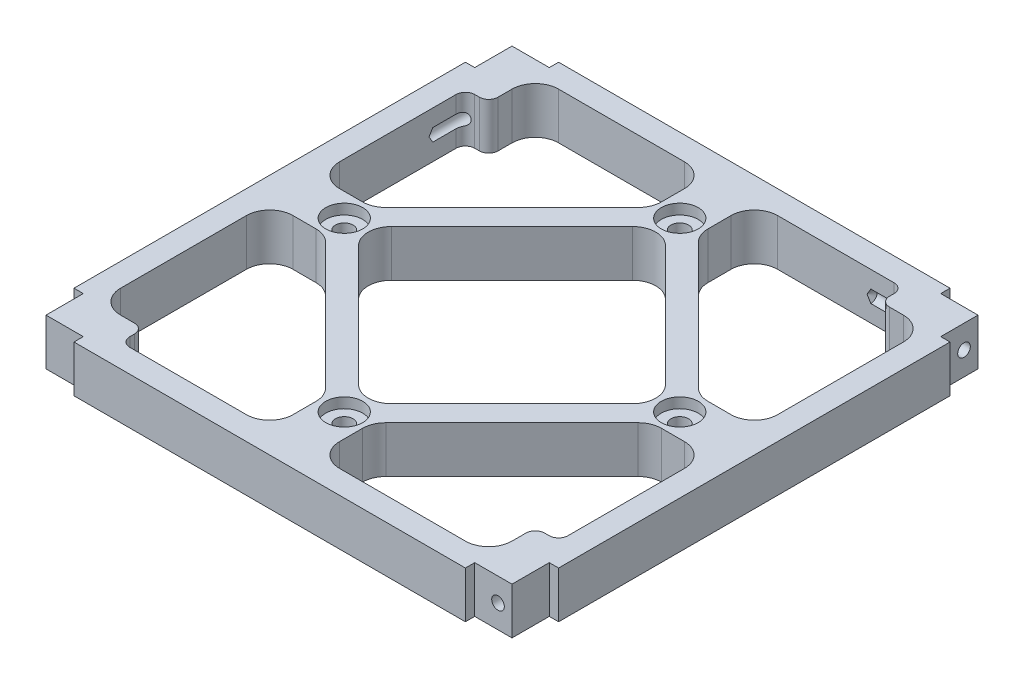
from build123d import *

# Parameters (mm, degrees)
SKETCH1_W                                           = 104
SKETCH1_H                                           = 104
BOSS_EXTRUDE1_DEPTH                                 = 10
FILLET1_R                                           = 5
CUT_EXTRUDE1_DEPTH                                  = 75.215901261
CIRPATTERN1_COUNT                                   = 4
CBORE_FOR_6_BINDING_HEAD_MACHINE_SCREW1_D           = 3.7973
CBORE_FOR_6_BINDING_HEAD_MACHINE_SCREW1_CBORE_D     = 7.9375
CBORE_FOR_6_BINDING_HEAD_MACHINE_SCREW1_CBORE_DEPTH = 2.2098
FILLET3_R                                           = 2
CIRPATTERN5_COUNT                                   = 4


with BuildPart() as part:
    # Sketch1 → Boss-Extrude1 (new body)
    with BuildSketch(Plane(origin=(0, 0, 0), x_dir=(1, 0, 0), z_dir=(0, 1, 0))):
        Rectangle(SKETCH1_W, SKETCH1_H)
        Polygon((-42, 47), (-42, 37), (-47, 37), (-47, 5), (-35, 5), (-5, 35), (-5, 47), align=None, mode=Mode.SUBTRACT)
        Polygon((-32.928932188, 0), (0, 32.928932188), (32.928932188, 0), (0, -32.928932188), align=None, mode=Mode.SUBTRACT)
        Polygon((5, 47), (5, 35), (35, 5), (47, 5), (47, 42), (37, 42), (37, 47), align=None, mode=Mode.SUBTRACT)
        Polygon((47, -5), (35, -5), (5, -35), (5, -47), (42, -47), (42, -37), (47, -37), align=None, mode=Mode.SUBTRACT)
        Polygon((-5, -47), (-5, -35), (-35, -5), (-47, -5), (-47, -42), (-37, -42), (-37, -47), align=None, mode=Mode.SUBTRACT)
    extrude(amount=BOSS_EXTRUDE1_DEPTH)

    # Fillet1
    fillet1_edges = [part.edges().sort_by_distance(p)[0] for p in [
        (32.928932188, 5, 0),
        (0, 5, 32.928932188),
        (-32.928932188, 5, 0),
        (0, 5, -32.928932188),
        (-5, 5, -47),
        (-5, 5, -35),
        (-35, 5, -5),
        (-47, 5, 42),
        (-47, 5, 5),
        (-35, 5, 5),
        (-5, 5, 35),
        (-5, 5, 47),
        (42, 5, 47),
        (47, 5, 5),
        (35, 5, 5),
        (5, 5, 35),
        (5, 5, 47),
        (47, 5, -42),
        (47, 5, -5),
        (35, 5, -5),
        (5, 5, -35),
        (5, 5, -47),
        (-42, 5, -47),
        (-47, 5, -5),
    ]]
    fillet(fillet1_edges, radius=FILLET1_R)

    # Sketch2 → Cut-Extrude1 (cut, through all)
    with BuildSketch(Plane(origin=(0, 10, 0), x_dir=(1, 0, 0), z_dir=(0, 1, 0))):
        Polygon((-52, 52), (-42, 52), (-42, 50), (-50, 50), (-50, 42), (-52, 42), align=None)
    cut_extrude1 = extrude(amount=-CUT_EXTRUDE1_DEPTH, mode=Mode.SUBTRACT)

    # CirPattern1: Cut-Extrude1 ×4 about axis
    cirpattern1_axis = Axis((0, 10.5, 0), (0, -1, 0))
    for i in range(1, CIRPATTERN1_COUNT):
        add(cut_extrude1.rotate(cirpattern1_axis, i * 360 / CIRPATTERN1_COUNT), mode=Mode.SUBTRACT)

    # CBORE for #6 Binding Head Machine Screw1 (through all)
    with Locations(Plane(origin=(0, 10, 0), x_dir=(1, 0, 0), z_dir=(0, 1, 0))):
        with Locations((0, 36), (-36, 0), (0, -36), (36, 0)):
            CounterBoreHole(CBORE_FOR_6_BINDING_HEAD_MACHINE_SCREW1_D / 2, CBORE_FOR_6_BINDING_HEAD_MACHINE_SCREW1_CBORE_D / 2, CBORE_FOR_6_BINDING_HEAD_MACHINE_SCREW1_CBORE_DEPTH)

    # Fillet3
    fillet3_edges = [part.edges().sort_by_distance(p)[0] for p in [
        (-37, 5, 42),
        (-37, 5, 47),
        (42, 5, 37),
        (47, 5, 37),
        (37, 5, -42),
        (37, 5, -47),
        (-47, 5, -37),
        (-42, 5, -37),
    ]]
    fillet(fillet3_edges, radius=FILLET3_R)

    # Sketch9 → #6-32 Tapped Hole1 (revolve, cut)
    with BuildSketch(Plane(origin=(50, 5, -47), x_dir=(0, 0, -1), z_dir=(0, 1, 0))):
        Polygon((0, 0), (0, 20.81269403), (1.35255, 20), (1.35255, 0), align=None)
    f_6_32_tapped_hole1 = revolve(axis=Axis((56.35, 5, -47), (-1, 0, 0)), mode=Mode.SUBTRACT)

    # CirPattern5: #6-32 Tapped Hole1 ×4 about axis
    cirpattern5_axis = Axis((0, 10.5, 0), (0, -1, 0))
    for i in range(1, CIRPATTERN5_COUNT):
        add(f_6_32_tapped_hole1.rotate(cirpattern5_axis, i * 360 / CIRPATTERN5_COUNT), mode=Mode.SUBTRACT)


solid = part.part
